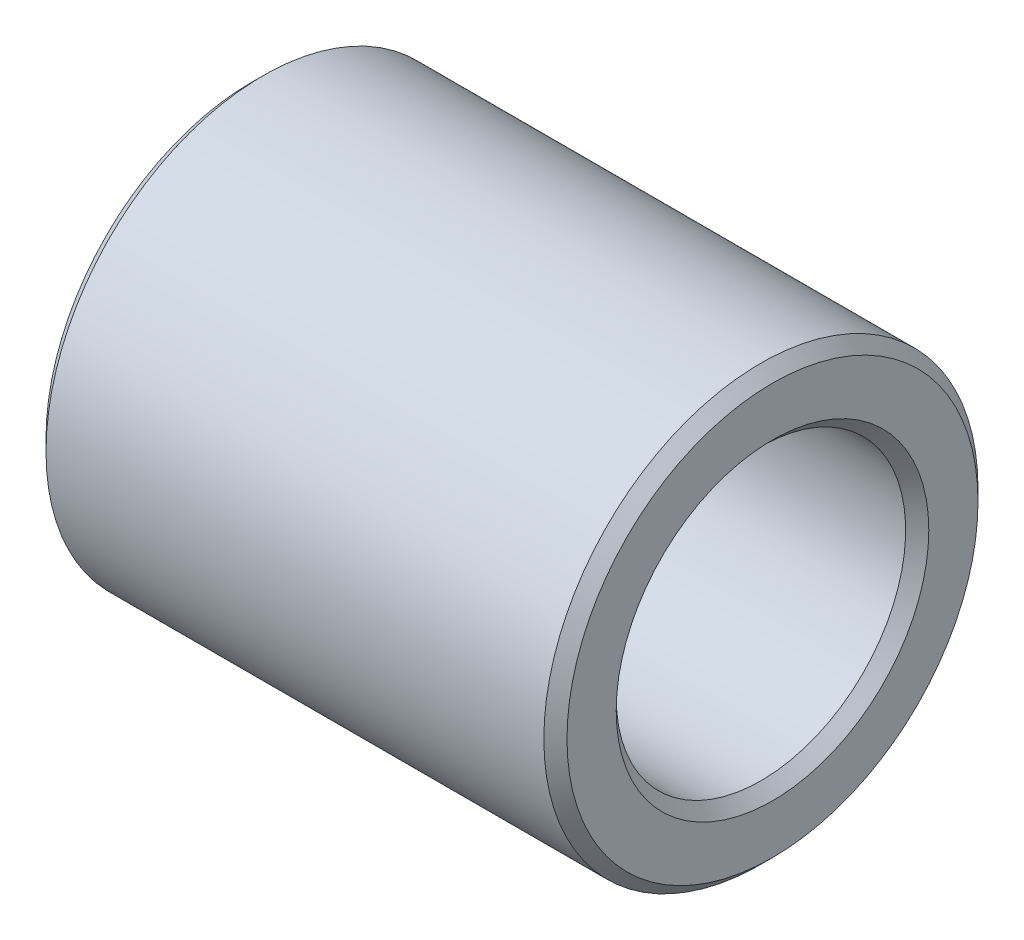
from build123d import *

# Parameters (mm, degrees)
SKETCH1_W     = 22.86
SKETCH1_H     = 3.175
CHAMFER1_SIZE = 0.508


with BuildPart() as part:
    # Sketch1 → Revolve1 (revolve)
    with BuildSketch(Plane.XY):
        with Locations((11.43, 7.9375)):
            Rectangle(SKETCH1_W, SKETCH1_H)
    revolve(axis=Axis((0, 0, 0), (1, 0, 0)))

    # Chamfer1
    chamfer1_edges = [part.edges().sort_by_distance(p)[0] for p in [
        (0, -6.35, 0),
        (0, -9.525, 0),
        (22.86, -6.35, 0),
        (22.86, -9.525, 0),
    ]]
    chamfer(chamfer1_edges, length=CHAMFER1_SIZE)


solid = part.part
